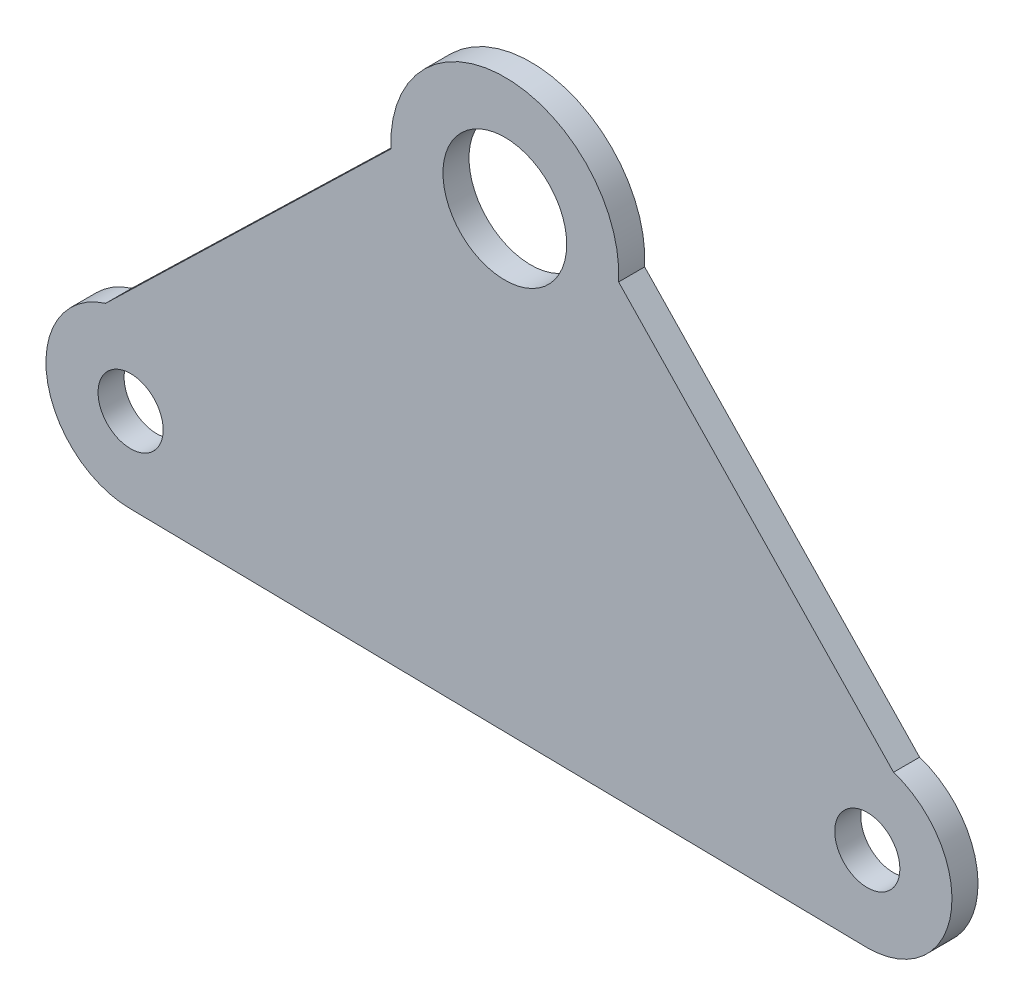
from build123d import *

# Parameters (mm, degrees)
SKETCH_1_R      = 5
EXTRUDE_1_DEPTH = 4


with BuildPart() as part:
    # 草图1 → 凸台-拉伸1 (new body)
    with BuildSketch(Plane.XY):
        with BuildLine():
            Line((-17.48190102, -0.795698889), (-61.300227546, -43.238973327))
            ThreePointArc((-61.300227546, -43.238973327), (-70.323163609, -57.561184168), (-57.541676248, -68.659502933))
            Line((-57.541676248, -68.659502933), (55.58103746, -70.462734288))
            ThreePointArc((55.58103746, -70.462734288), (68.492507906, -59.541457088), (59.688479475, -45.102985974))
            Line((59.688479475, -45.102985974), (17.470783628, -1.010801384))
            ThreePointArc((17.470783628, -1.010801384), (0.1076948, 17.499668621), (-17.48190102, -0.795698889))
        make_face()
        with Locations((-57.462972532, -55.659741176)):
            Circle(SKETCH_1_R, mode=Mode.SUBTRACT)
        with BuildLine():
            ThreePointArc((60.659741176, -57.462972532), (52.12420727, -60.998506438), (55.659741176, -52.462972532))
            ThreePointArc((55.659741176, -52.462972532), (59.195275082, -53.927438626), (60.659741176, -57.462972532))
        make_face(mode=Mode.SUBTRACT)
        with BuildLine():
            ThreePointArc((9.5, 0), (9.32744477, -1.802435591), (8.816047566, -3.539393354))
            ThreePointArc((8.816047566, -3.539393354), (-9.32744477, 1.802435591), (9.5, 0))
        make_face(mode=Mode.SUBTRACT)
    extrude(amount=EXTRUDE_1_DEPTH)


solid = part.part
